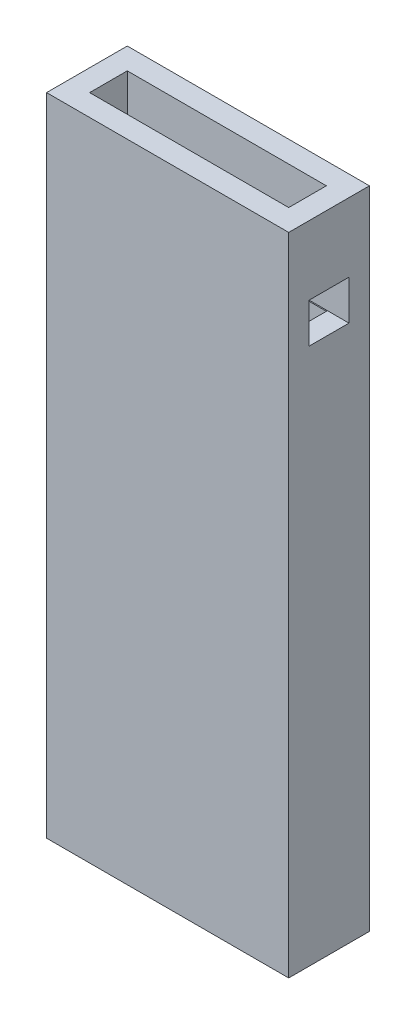
from build123d import *

# Parameters (mm, degrees)
SKETCH1_W                   = 45
SKETCH1_H                   = 15
BOSS_EXTRUDE1_DEPTH         = 60
SHELL1_T                    = -4
SHELL1_THICKNESS_2_FACE_W   = 7
SHELL1_THICKNESS_2_FACE_H   = 37
SHELL1_THICKNESS_2_DEPTH    = 2
CUT_EXTRUDE3_REACH          = 67.812
SKETCH4_W                   = 10
SKETCH4_H                   = 10
SKETCH5_W                   = 7.4
SKETCH5_H                   = 7.4
CUT_EXTRUDE4_DEPTH          = 76.374067158
CUT_EXTRUDE5_START          = -1.2
CUT_EXTRUDE5_DEPTH          = 3.6
CUT_EXTRUDE6_REACH          = 124.321
SKETCH7_R                   = 2.1
BODY_MOVE_COPY1_START       = -7.5
BODY_MOVE_COPY1_OUTLINE_W   = 10
BODY_MOVE_COPY1_OUTLINE_H   = 10
BODY_MOVE_COPY1_DEPTH       = 4
BODY_MOVE_COPY1_START_2     = 3.7
BODY_MOVE_COPY1_2_OUTLINE_W = 10
BODY_MOVE_COPY1_2_OUTLINE_H = 10
BODY_MOVE_COPY1_2_DEPTH     = 3.8
BODY_MOVE_COPY1_START_3     = 3.5
BODY_MOVE_COPY1_3_OUTLINE_W = 10
BODY_MOVE_COPY1_3_OUTLINE_H = 2.8
BODY_MOVE_COPY1_3_DEPTH     = 0.2


# Read off the part's stored shape, not the designer's step: Body-Move/Copy1
with BuildPart() as part:
    # Sketch1 → Boss-Extrude1 (new, symmetric)
    with BuildSketch(Plane(origin=(0, 0, 0), x_dir=(1, 0, 0), z_dir=(0, 1, 0))):
        Rectangle(SKETCH1_W, SKETCH1_H)
    extrude(amount=BOSS_EXTRUDE1_DEPTH, both=True)

    # Shell1
    shell1_openings = [part.faces().sort_by_distance(p)[0] for p in [
        (0, 60, 0),
    ]]
    offset(amount=SHELL1_T, openings=shell1_openings, kind=Kind.INTERSECTION)

    # Shell1 thickness 2 face (on inner face of the shell) → Shell1 thickness 2 (add)
    with BuildSketch(Plane(origin=(0, -56, 0), x_dir=(0, 0, -1), z_dir=(0, -1, 0))):
        Rectangle(SHELL1_THICKNESS_2_FACE_W, SHELL1_THICKNESS_2_FACE_H)
    extrude(amount=-SHELL1_THICKNESS_2_DEPTH)

    # Sketch4 → Cut-Extrude3 (cut, up to next)
    with BuildSketch(Plane.XY.offset(7.5), mode=Mode.PRIVATE) as cut_extrude3_sk1:
        with Locations((0, 45)):
            Rectangle(SKETCH4_W, SKETCH4_H)
    cut_extrude3_tool1 = extrude(cut_extrude3_sk1.sketch, amount=-CUT_EXTRUDE3_REACH, mode=Mode.PRIVATE) & part.part
    add(cut_extrude3_tool1.solids().sort_by_distance((0, 45, 7.5))[0], mode=Mode.SUBTRACT)

    # Sketch5 → Cut-Extrude4 (cut, through all)
    with BuildSketch(Plane(origin=(22.5, 0, 0), x_dir=(0, 0, -1), z_dir=(1, 0, 0))):
        with Locations((0, 43.5)):
            Rectangle(SKETCH5_W, SKETCH5_H)
    extrude(amount=-CUT_EXTRUDE4_DEPTH, mode=Mode.SUBTRACT)

    # Sketch6 → Cut-Extrude5 (cut)
    with BuildSketch(Plane.XZ.offset(60).offset(CUT_EXTRUDE5_START)):
        Polygon((-15, 4.272391992), (-18.7, 2.136195996), (-18.7, -2.136195996), (-15, -4.272391992), (-11.3, -2.136195996), (-11.3, 2.136195996), align=None)
        Polygon((11.3, 2.136195996), (15, 4.272391992), (18.7, 2.136195996), (18.7, -2.136195996), (15, -4.272391992), (11.3, -2.136195996), align=None)
    extrude(amount=-CUT_EXTRUDE5_DEPTH, mode=Mode.SUBTRACT)

    # Sketch7 → Cut-Extrude6 (cut, up to next)
    with BuildSketch(Plane.XZ.offset(60), mode=Mode.PRIVATE) as cut_extrude6_sk1:
        with Locations(Location((-15, 0, 0), (0, 0, 270))):
            Circle(SKETCH7_R)
    cut_extrude6_tool1 = extrude(cut_extrude6_sk1.sketch, amount=-CUT_EXTRUDE6_REACH, mode=Mode.PRIVATE) & part.part
    # Sketch7 → Cut-Extrude6 (cut, up to next)
    with BuildSketch(Plane.XZ.offset(60), mode=Mode.PRIVATE) as cut_extrude6_sk2:
        with Locations(Location((15, 0, 0), (0, 0, 90))):
            Circle(SKETCH7_R)
    cut_extrude6_tool2 = extrude(cut_extrude6_sk2.sketch, amount=-CUT_EXTRUDE6_REACH, mode=Mode.PRIVATE) & part.part
    add(cut_extrude6_tool1.solids().sort_by_distance((-15, -60, 0))[0], mode=Mode.SUBTRACT)
    add(cut_extrude6_tool2.solids().sort_by_distance((15, -60, 0))[0], mode=Mode.SUBTRACT)

    # Body-Move/Copy1 outline → Body-Move/Copy1 (cut)
    with BuildSketch(Plane.XY.offset(BODY_MOVE_COPY1_START)):
        with Locations((0, 45)):
            Rectangle(BODY_MOVE_COPY1_OUTLINE_W, BODY_MOVE_COPY1_OUTLINE_H)
    extrude(amount=BODY_MOVE_COPY1_DEPTH, mode=Mode.SUBTRACT)

    # Body-Move_Copy1 2 outline → Body-Move_Copy1 2 (add)
    with BuildSketch(Plane.XY.offset(BODY_MOVE_COPY1_START_2)):
        with Locations((0, 45)):
            Rectangle(BODY_MOVE_COPY1_2_OUTLINE_W, BODY_MOVE_COPY1_2_OUTLINE_H)
    extrude(amount=BODY_MOVE_COPY1_2_DEPTH)

    # Body-Move_Copy1 3 outline → Body-Move_Copy1 3 (add)
    with BuildSketch(Plane.XY.offset(BODY_MOVE_COPY1_START_3)):
        with Locations((0, 48.6)):
            Rectangle(BODY_MOVE_COPY1_3_OUTLINE_W, BODY_MOVE_COPY1_3_OUTLINE_H)
    extrude(amount=BODY_MOVE_COPY1_3_DEPTH)


solid = part.part
